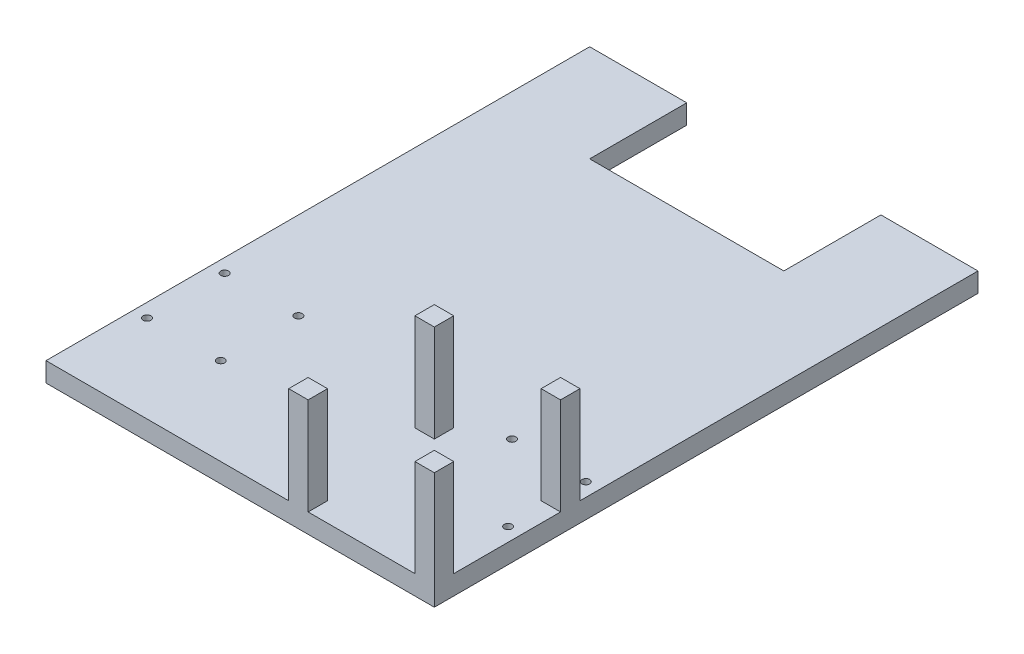
from build123d import *

# Parameters (mm, degrees)
SKETCH3_W           = 200
SKETCH3_H           = 280
BOSS_EXTRUDE1_DEPTH = 10
SKETCH4_W           = 10
SKETCH4_H           = 10
BOSS_EXTRUDE2_DEPTH = 50
SKETCH7_R           = 2
SKETCH7_R_2         = 2.000000006
SKETCH7_R_3         = 1.999999994
CUT_EXTRUDE2_DEPTH  = 10
SKETCH9_W           = 100
SKETCH9_H           = 50
CUT_EXTRUDE4_DEPTH  = 10


with BuildPart() as part:
    # Sketch3 → Boss-Extrude1 (new body)
    with BuildSketch(Plane(origin=(0, 0, 0), x_dir=(1, 0, 0), z_dir=(0, 1, 0))):
        Rectangle(SKETCH3_W, SKETCH3_H)
    extrude(amount=BOSS_EXTRUDE1_DEPTH)

    # Sketch4 → Boss-Extrude2 (add)
    with BuildSketch(Plane(origin=(0, 10, 0), x_dir=(1, 0, 0), z_dir=(0, 1, 0))):
        with Locations((95, -135)):
            Rectangle(SKETCH4_W, SKETCH4_H)
        with Locations((95, -70)):
            Rectangle(SKETCH4_W, SKETCH4_H)
        with Locations((30, -135)):
            Rectangle(SKETCH4_W, SKETCH4_H)
        with Locations((30, -70)):
            Rectangle(SKETCH4_W, SKETCH4_H)
    extrude(amount=BOSS_EXTRUDE2_DEPTH)

    # Sketch7 → Cut-Extrude2 (cut)
    with BuildSketch(Plane.XZ):
        with Locations((-93, 55)):
            Circle(SKETCH7_R)
        with Locations((-93, 95)):
            Circle(SKETCH7_R)
        with Locations((-55, 95)):
            Circle(SKETCH7_R_2)
        with Locations((-55, 55)):
            Circle(SKETCH7_R)
        with Locations((55, 95)):
            Circle(SKETCH7_R_3)
        with Locations((93, 95)):
            Circle(SKETCH7_R)
        with Locations((93, 55)):
            Circle(SKETCH7_R)
        with Locations((55, 55)):
            Circle(SKETCH7_R)
    extrude(amount=-CUT_EXTRUDE2_DEPTH, mode=Mode.SUBTRACT)

    # Sketch9 → Cut-Extrude4 (cut)
    with BuildSketch(Plane(origin=(0, 10, 0), x_dir=(1, 0, 0), z_dir=(0, 1, 0))):
        with Locations((0, 115)):
            Rectangle(SKETCH9_W, SKETCH9_H)
    extrude(amount=-CUT_EXTRUDE4_DEPTH, mode=Mode.SUBTRACT)


solid = part.part
